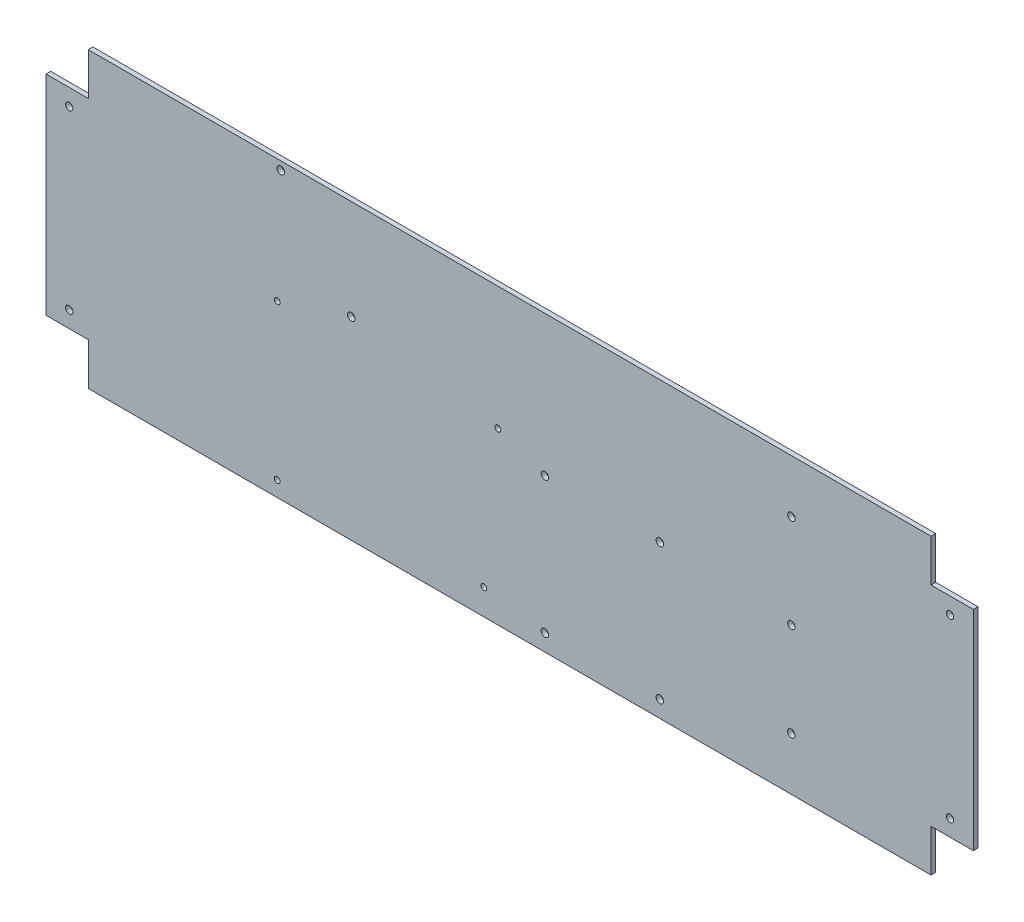
from build123d import *

# Parameters (mm, degrees)
SKETCH1_W               = 395
SKETCH1_H               = 125
BOSS_EXTRUDE1_DEPTH     = 2
SKETCH2_R               = 1.55
FIXING_HOLES_DEPTH      = 208.162979318
SKETCH3_W               = 18
SKETCH3_H               = 18
CUT_EXTRUDE2_DEPTH      = 208.162979318
MIRROR2_COPY_1_SKETCH_W = 18
MIRROR2_COPY_1_SKETCH_H = 18
MIRROR2_COPY_1_DEPTH    = 208.162979318
MIRROR2_COPY_2_SKETCH_W = 18
MIRROR2_COPY_2_SKETCH_H = 18
MIRROR2_COPY_2_DEPTH    = 208.162979318
SKETCH4_R               = 1.25
CAVE_BOARD_HOLES_DEPTH  = 208.162979318
SKETCH5_R               = 1.6
RPI_HOLES_DEPTH         = 208.162979318
SKETCH6_R               = 1.6
BUZZER_HOLES_DEPTH      = 208.162979318
SKETCH7_R               = 1.6
RELAYS_HOLES_DEPTH      = 208.162979318


with BuildPart() as part:
    # Sketch1 → Boss-Extrude1 (new body)
    with BuildSketch(Plane.XY):
        Rectangle(SKETCH1_W, SKETCH1_H)
    extrude(amount=BOSS_EXTRUDE1_DEPTH)

    # Sketch2 → Fixing_holes (cut, through all)
    with BuildSketch(Plane.XY.offset(2)):
        with Locations((-187.6, 37.5)):
            Circle(SKETCH2_R)
        with Locations((-187.6, -37.5)):
            Circle(SKETCH2_R)
        with Locations((187.6, 37.5)):
            Circle(SKETCH2_R)
        with Locations((187.6, -37.5)):
            Circle(SKETCH2_R)
    extrude(amount=-FIXING_HOLES_DEPTH, mode=Mode.SUBTRACT)

    # Sketch3 → Cut-Extrude2 (cut, through all)
    with BuildSketch(Plane.XY.offset(2)):
        with Locations((-188.5, 53.5)):
            Rectangle(SKETCH3_W, SKETCH3_H)
    cut_extrude2 = extrude(amount=-CUT_EXTRUDE2_DEPTH, mode=Mode.SUBTRACT)

    # Mirror1: Cut-Extrude2 across plane
    add(cut_extrude2.mirror(Plane.ZX), mode=Mode.SUBTRACT)

    # Mirror2 copy 1 sketch → Mirror2 copy 1 (cut, through all)
    with BuildSketch(Plane(origin=(0, 0, 2), x_dir=(-1, 0, 0), z_dir=(0, 0, 1))):
        with Locations((-188.5, 53.5)):
            Rectangle(MIRROR2_COPY_1_SKETCH_W, MIRROR2_COPY_1_SKETCH_H)
    extrude(amount=-MIRROR2_COPY_1_DEPTH, mode=Mode.SUBTRACT)

    # Mirror2 copy 2 sketch → Mirror2 copy 2 (cut, through all)
    with BuildSketch(Plane(origin=(0, 0, 2), x_dir=(-1, 0, 0), z_dir=(0, 0, 1))):
        with Locations((-188.5, -53.5)):
            Rectangle(MIRROR2_COPY_2_SKETCH_W, MIRROR2_COPY_2_SKETCH_H)
    extrude(amount=-MIRROR2_COPY_2_DEPTH, mode=Mode.SUBTRACT)

    # Sketch4 → Cave_board_holes (cut, through all)
    with BuildSketch(Plane.XY.offset(2)):
        with Locations((-99, 10)):
            Circle(SKETCH4_R)
        with Locations((-99, -56)):
            Circle(SKETCH4_R)
        with Locations((-5, 10)):
            Circle(SKETCH4_R)
        with Locations((-11, -51.5)):
            Circle(SKETCH4_R)
    extrude(amount=-CAVE_BOARD_HOLES_DEPTH, mode=Mode.SUBTRACT)

    # Sketch5 → RPi_holes (cut, through all)
    with BuildSketch(Plane.XY.offset(2)):
        with Locations((15, 2.6)):
            Circle(SKETCH5_R)
        with Locations((15, -55.4)):
            Circle(SKETCH5_R)
        with Locations((64, 2.6)):
            Circle(SKETCH5_R)
        with Locations((64, -55.4)):
            Circle(SKETCH5_R)
    extrude(amount=-RPI_HOLES_DEPTH, mode=Mode.SUBTRACT)

    # Sketch6 → buzzer_holes (cut, through all)
    with BuildSketch(Plane.XY.offset(2)):
        with Locations((-97.5, 59)):
            Circle(SKETCH6_R)
        with Locations((-67.5, 20)):
            Circle(SKETCH6_R)
    extrude(amount=-BUZZER_HOLES_DEPTH, mode=Mode.SUBTRACT)

    # Sketch7 → relays_holes (cut, through all)
    with BuildSketch(Plane.XY.offset(2)):
        with Locations((120, 0)):
            Circle(SKETCH7_R)
        with Locations((120, 40)):
            Circle(SKETCH7_R)
        with Locations((120, -40)):
            Circle(SKETCH7_R)
    extrude(amount=-RELAYS_HOLES_DEPTH, mode=Mode.SUBTRACT)


solid = part.part
